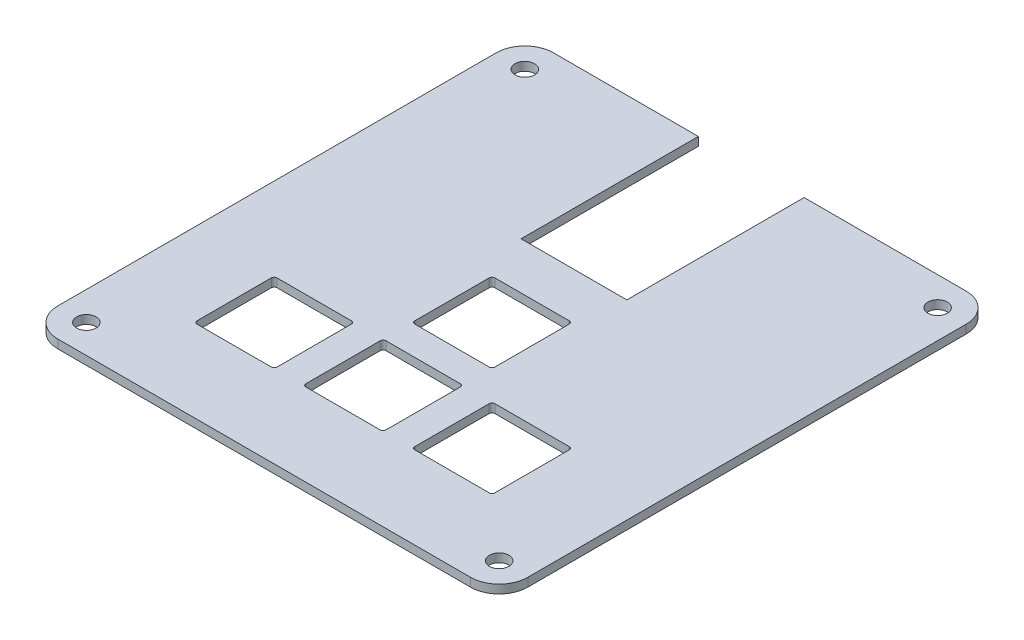
from build123d import *

# Parameters (mm, degrees)
SKETCH2_R               = 1.7
BOSS_EXTRUDE3_DEPTH     = 1.5
CUT_EXTRUDE5_DEPTH      = 7
CUT_EXTRUDE5_DEPTH_BACK = 4.5
FILLET4_R               = 5


with BuildPart() as part:
    # Sketch2 → Boss-Extrude3 (new body)
    with BuildSketch(Plane(origin=(0, 0, 0), x_dir=(1, 0, 0), z_dir=(0, 1, 0))):
        Polygon((41.498193182, -31.056403409), (41.498193182, 55.623596591), (8.148193182, 55.623596591), (8.148193182, 24.623596591), (-10.351806818, 24.623596591), (-10.351806818, 55.623596591), (-40.691806818, 55.623596591), (-40.691806818, -31.056403409), align=None)
        with Locations((-35.691806818, -26.056403409)):
            Circle(SKETCH2_R, mode=Mode.SUBTRACT)
        with Locations((36.498193182, -26.056403409)):
            Circle(SKETCH2_R, mode=Mode.SUBTRACT)
        with Locations((-35.691806818, 50.623596591)):
            Circle(SKETCH2_R, mode=Mode.SUBTRACT)
        with Locations((36.498193182, 50.623596591)):
            Circle(SKETCH2_R, mode=Mode.SUBTRACT)
    extrude(amount=BOSS_EXTRUDE3_DEPTH)

    # Sketch1 → Cut-Extrude5 (cut, two sides: drawn at the far end of the back side and taken through both)
    with BuildSketch(Plane(origin=(0, 0, 0), x_dir=(1, 0, 0), z_dir=(0, 1, 0)).offset(-CUT_EXTRUDE5_DEPTH_BACK)):
        with BuildLine():
            Line((-6.720806818, 16.414596591), (6.279193182, 16.414596591))
            ThreePointArc((6.279193182, 16.414596591), (6.632746572, 16.268149982), (6.779193182, 15.914596591))
            Line((6.779193182, 15.914596591), (6.779193182, 2.914596591))
            ThreePointArc((6.779193182, 2.914596591), (6.632746572, 2.5610432), (6.279193182, 2.414596591))
            Line((6.279193182, 2.414596591), (-6.720806818, 2.414596591))
            ThreePointArc((-6.720806818, 2.414596591), (-7.074360209, 2.5610432), (-7.220806818, 2.914596591))
            Line((-7.220806818, 2.914596591), (-7.220806818, 15.914596591))
            ThreePointArc((-7.220806818, 15.914596591), (-7.074360209, 16.268149982), (-6.720806818, 16.414596591))
        make_face()
        with BuildLine():
            Line((-25.770806818, -2.635403409), (-12.770806818, -2.635403409))
            ThreePointArc((-12.770806818, -2.635403409), (-12.417253428, -2.781850018), (-12.270806818, -3.135403409))
            Line((-12.270806818, -3.135403409), (-12.270806818, -16.135403409))
            ThreePointArc((-12.270806818, -16.135403409), (-12.417253428, -16.4889568), (-12.770806818, -16.635403409))
            Line((-12.770806818, -16.635403409), (-25.770806818, -16.635403409))
            ThreePointArc((-25.770806818, -16.635403409), (-26.124360209, -16.4889568), (-26.270806818, -16.135403409))
            Line((-26.270806818, -16.135403409), (-26.270806818, -3.135403409))
            ThreePointArc((-26.270806818, -3.135403409), (-26.124360209, -2.781850018), (-25.770806818, -2.635403409))
        make_face()
        with BuildLine():
            Line((-6.720806818, -2.635403409), (6.279193182, -2.635403409))
            ThreePointArc((6.279193182, -2.635403409), (6.632746572, -2.781850018), (6.779193182, -3.135403409))
            Line((6.779193182, -3.135403409), (6.779193182, -16.135403409))
            ThreePointArc((6.779193182, -16.135403409), (6.632746572, -16.4889568), (6.279193182, -16.635403409))
            Line((6.279193182, -16.635403409), (-6.720806818, -16.635403409))
            ThreePointArc((-6.720806818, -16.635403409), (-7.074360209, -16.4889568), (-7.220806818, -16.135403409))
            Line((-7.220806818, -16.135403409), (-7.220806818, -3.135403409))
            ThreePointArc((-7.220806818, -3.135403409), (-7.074360209, -2.781850018), (-6.720806818, -2.635403409))
        make_face()
        with BuildLine():
            Line((12.329193182, -2.635403409), (25.329193182, -2.635403409))
            ThreePointArc((25.329193182, -2.635403409), (25.682746572, -2.781850018), (25.829193182, -3.135403409))
            Line((25.829193182, -3.135403409), (25.829193182, -16.135403409))
            ThreePointArc((25.829193182, -16.135403409), (25.682746572, -16.4889568), (25.329193182, -16.635403409))
            Line((25.329193182, -16.635403409), (12.329193182, -16.635403409))
            ThreePointArc((12.329193182, -16.635403409), (11.975639791, -16.4889568), (11.829193182, -16.135403409))
            Line((11.829193182, -16.135403409), (11.829193182, -3.135403409))
            ThreePointArc((11.829193182, -3.135403409), (11.975639791, -2.781850018), (12.329193182, -2.635403409))
        make_face()
    extrude(amount=CUT_EXTRUDE5_DEPTH + CUT_EXTRUDE5_DEPTH_BACK, mode=Mode.SUBTRACT)

    # Fillet4
    fillet4_edges = [part.edges().sort_by_distance(p)[0] for p in [
        (-40.691806818, 0.75, 31.056403409),
        (41.498193182, 0.75, 31.056403409),
        (41.498193182, 0.75, -55.623596591),
        (-40.691806818, 0.75, -55.623596591),
    ]]
    fillet(fillet4_edges, radius=FILLET4_R)


solid = part.part
